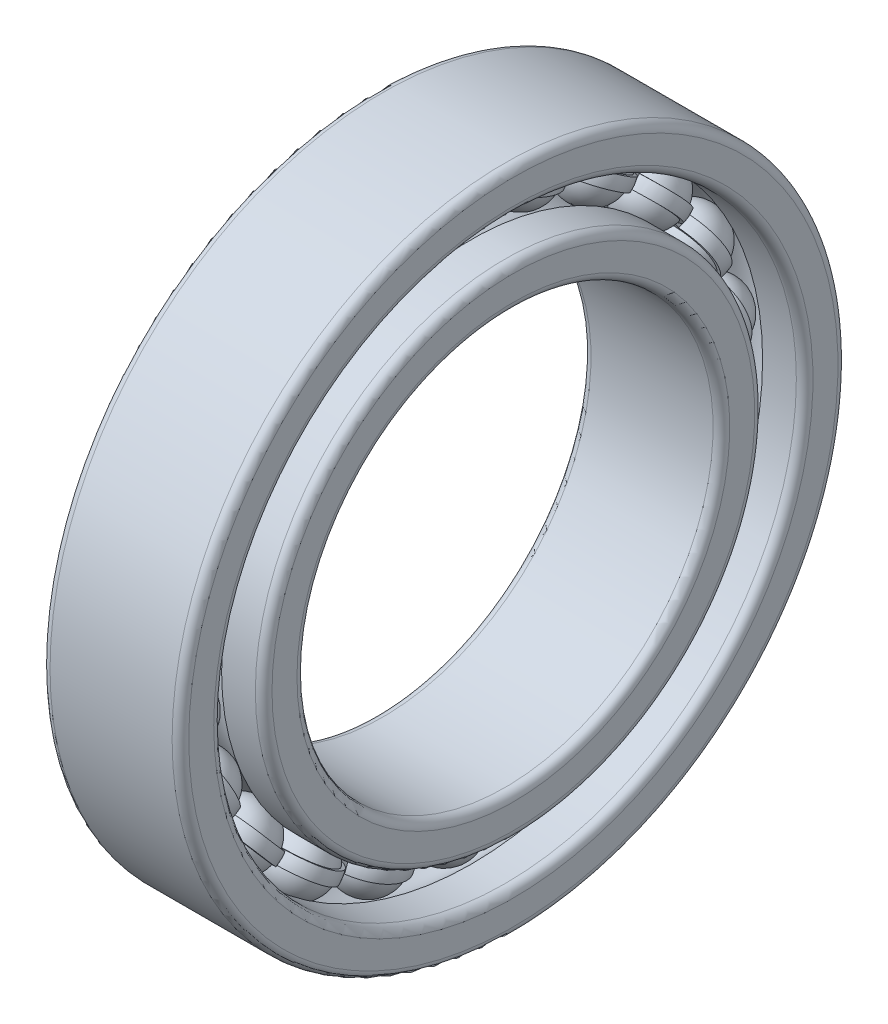
from build123d import *
from build123d.topology import SkipClean

# Parameters (mm, degrees)
SKETCH_5_W               = 0.6749999999999998
SKETCH_5_H               = 0.45000000000000107
PATTERN_CIRCULAR_5_COUNT = 22
PATTERN_CIRCULAR_2_COUNT = 22


with BuildPart() as part:
    # 草图2 → 旋转1 (revolve)
    with BuildSketch(Plane.XY):
        with BuildLine():
            Line((2.2000000000000015, 7.5), (-2.199999999999999, 7.499999999999998))
            ThreePointArc((-2.199999999999999, 7.499999999999998), (-2.412132034355963, 7.587867965644034), (-2.4999999999999987, 7.799999999999998))
            Line((-2.4999999999999987, 7.799999999999998), (-2.499999999999998, 8.7))
            ThreePointArc((-2.499999999999998, 8.7), (-2.4121320343559622, 8.912132034355963), (-2.199999999999999, 8.999999999999998))
            Line((-2.199999999999999, 8.999999999999998), (-0.838525491562419, 8.999999999999998))
            ThreePointArc((-0.838525491562419, 8.999999999999998), (4.2e-16, 8.625), (0.838525491562419, 8.999999999999998))
            Line((0.838525491562419, 8.999999999999998), (2.2000000000000015, 8.999999999999998))
            ThreePointArc((2.2000000000000015, 8.999999999999998), (2.412132034355965, 8.912132034355963), (2.5000000000000004, 8.7))
            Line((2.5000000000000004, 8.7), (2.5000000000000013, 7.8))
            ThreePointArc((2.5000000000000013, 7.8), (2.412132034355966, 7.587867965644036), (2.2000000000000015, 7.5))
        make_face()
        with BuildLine():
            Line((-2.4999999999999982, 11.700000000000001), (-2.4999999999999987, 10.8))
            ThreePointArc((-2.4999999999999987, 10.8), (-2.412132034355963, 10.587867965644037), (-2.199999999999999, 10.5))
            Line((-2.199999999999999, 10.5), (-0.8385254915624187, 10.500000000000002))
            ThreePointArc((-0.8385254915624187, 10.500000000000002), (6.7e-16, 10.874999999999998), (0.8385254915624187, 10.500000000000002))
            Line((0.8385254915624187, 10.500000000000002), (2.2000000000000015, 10.500000000000002))
            ThreePointArc((2.2000000000000015, 10.500000000000002), (2.412132034355965, 10.587867965644037), (2.5000000000000004, 10.8))
            Line((2.5000000000000004, 10.8), (2.5000000000000013, 11.700000000000001))
            ThreePointArc((2.5000000000000013, 11.700000000000001), (2.412132034355966, 11.912132034355965), (2.2000000000000015, 12))
            Line((2.2000000000000015, 12), (-2.199999999999999, 12))
            ThreePointArc((-2.199999999999999, 12), (-2.4121320343559622, 11.912132034355965), (-2.4999999999999982, 11.700000000000001))
        make_face()
    revolve(axis=Axis((-3.4999999999999996, 0, 0), (1, 0, 0)))


with BuildPart() as body_2:
    # 草图5 → 旋转3 (revolve)
    with BuildSketch(Plane.XY):
        with Locations((3.36e-15, 9.75)):
            Rectangle(SKETCH_5_W, SKETCH_5_H)
    revolve(axis=Axis((-19.927092192426834, 0, 0), (1, 0, 0)))



with BuildPart() as body_3:
    # 草图3 → 旋转2 (revolve)
    with BuildSketch(Plane.XY):
        with BuildLine():
            ThreePointArc((1.2374999999999976, 9.75), (-1.6e-16, 10.987499999999995), (-1.2374999999999976, 9.75))
            Line((-1.2374999999999978, 9.75), (1.2374999999999978, 9.75))
        make_face()
    revolve(axis=Axis((-1.2374999999999978, 9.75, 0), (1, 0, 0)))


with BuildPart() as pattern_circular_5_1:
    # 阵列(圆周)5: pattern copy
    add(body_3.part.rotate(Axis((-3.850000000000002, 0, 0), (1, 0, 0)), 1 * 360 / PATTERN_CIRCULAR_5_COUNT))


with BuildPart() as pattern_circular_5_2:
    # 阵列(圆周)5: pattern copy
    add(body_3.part.rotate(Axis((-3.850000000000002, 0, 0), (1, 0, 0)), 2 * 360 / PATTERN_CIRCULAR_5_COUNT))


with BuildPart() as pattern_circular_5_3:
    # 阵列(圆周)5: pattern copy
    add(body_3.part.rotate(Axis((-3.850000000000002, 0, 0), (1, 0, 0)), 3 * 360 / PATTERN_CIRCULAR_5_COUNT))


with BuildPart() as pattern_circular_5_4:
    # 阵列(圆周)5: pattern copy
    add(body_3.part.rotate(Axis((-3.850000000000002, 0, 0), (1, 0, 0)), 4 * 360 / PATTERN_CIRCULAR_5_COUNT))


with BuildPart() as pattern_circular_5_5:
    # 阵列(圆周)5: pattern copy
    add(body_3.part.rotate(Axis((-3.850000000000002, 0, 0), (1, 0, 0)), 5 * 360 / PATTERN_CIRCULAR_5_COUNT))


with BuildPart() as pattern_circular_5_6:
    # 阵列(圆周)5: pattern copy
    add(body_3.part.rotate(Axis((-3.850000000000002, 0, 0), (1, 0, 0)), 6 * 360 / PATTERN_CIRCULAR_5_COUNT))


with BuildPart() as pattern_circular_5_7:
    # 阵列(圆周)5: pattern copy
    add(body_3.part.rotate(Axis((-3.850000000000002, 0, 0), (1, 0, 0)), 7 * 360 / PATTERN_CIRCULAR_5_COUNT))


with BuildPart() as pattern_circular_5_8:
    # 阵列(圆周)5: pattern copy
    add(body_3.part.rotate(Axis((-3.850000000000002, 0, 0), (1, 0, 0)), 8 * 360 / PATTERN_CIRCULAR_5_COUNT))


with BuildPart() as pattern_circular_5_9:
    # 阵列(圆周)5: pattern copy
    add(body_3.part.rotate(Axis((-3.850000000000002, 0, 0), (1, 0, 0)), 9 * 360 / PATTERN_CIRCULAR_5_COUNT))


with BuildPart() as pattern_circular_5_10:
    # 阵列(圆周)5: pattern copy
    add(body_3.part.rotate(Axis((-3.850000000000002, 0, 0), (1, 0, 0)), 10 * 360 / PATTERN_CIRCULAR_5_COUNT))


with BuildPart() as pattern_circular_5_11:
    # 阵列(圆周)5: pattern copy
    add(body_3.part.rotate(Axis((-3.850000000000002, 0, 0), (1, 0, 0)), 11 * 360 / PATTERN_CIRCULAR_5_COUNT))


with BuildPart() as pattern_circular_5_12:
    # 阵列(圆周)5: pattern copy
    add(body_3.part.rotate(Axis((-3.850000000000002, 0, 0), (1, 0, 0)), 12 * 360 / PATTERN_CIRCULAR_5_COUNT))


with BuildPart() as pattern_circular_5_13:
    # 阵列(圆周)5: pattern copy
    add(body_3.part.rotate(Axis((-3.850000000000002, 0, 0), (1, 0, 0)), 13 * 360 / PATTERN_CIRCULAR_5_COUNT))


with BuildPart() as pattern_circular_5_14:
    # 阵列(圆周)5: pattern copy
    add(body_3.part.rotate(Axis((-3.850000000000002, 0, 0), (1, 0, 0)), 14 * 360 / PATTERN_CIRCULAR_5_COUNT))


with BuildPart() as pattern_circular_5_15:
    # 阵列(圆周)5: pattern copy
    add(body_3.part.rotate(Axis((-3.850000000000002, 0, 0), (1, 0, 0)), 15 * 360 / PATTERN_CIRCULAR_5_COUNT))


with BuildPart() as pattern_circular_5_16:
    # 阵列(圆周)5: pattern copy
    add(body_3.part.rotate(Axis((-3.850000000000002, 0, 0), (1, 0, 0)), 16 * 360 / PATTERN_CIRCULAR_5_COUNT))


with BuildPart() as pattern_circular_5_17:
    # 阵列(圆周)5: pattern copy
    add(body_3.part.rotate(Axis((-3.850000000000002, 0, 0), (1, 0, 0)), 17 * 360 / PATTERN_CIRCULAR_5_COUNT))


with BuildPart() as pattern_circular_5_18:
    # 阵列(圆周)5: pattern copy
    add(body_3.part.rotate(Axis((-3.850000000000002, 0, 0), (1, 0, 0)), 18 * 360 / PATTERN_CIRCULAR_5_COUNT))


with BuildPart() as pattern_circular_5_19:
    # 阵列(圆周)5: pattern copy
    add(body_3.part.rotate(Axis((-3.850000000000002, 0, 0), (1, 0, 0)), 19 * 360 / PATTERN_CIRCULAR_5_COUNT))


with BuildPart() as pattern_circular_5_20:
    # 阵列(圆周)5: pattern copy
    add(body_3.part.rotate(Axis((-3.850000000000002, 0, 0), (1, 0, 0)), 20 * 360 / PATTERN_CIRCULAR_5_COUNT))


with BuildPart() as pattern_circular_5_21:
    # 阵列(圆周)5: pattern copy
    add(body_3.part.rotate(Axis((-3.850000000000002, 0, 0), (1, 0, 0)), 21 * 360 / PATTERN_CIRCULAR_5_COUNT))


with BuildPart() as cut_revolve_1_tool:
    # 草图6 → 切除-旋转1 (revolve)
    with BuildSketch(Plane.XY):
        with BuildLine():
            Line((-1.2168735554690948, 9.974999999999998), (1.2168735554690948, 9.974999999999998))
            ThreePointArc((1.2168735554690948, 9.974999999999998), (1.65e-15, 10.987499999999997), (-1.2168735554690948, 9.974999999999998))
        make_face()
        with BuildLine():
            Line((-1.2168735554690948, 9.525000000000002), (1.2168735554690948, 9.525000000000002))
            ThreePointArc((1.2168735554690948, 9.525000000000002), (1.65e-15, 8.5125), (-1.2168735554690948, 9.525000000000002))
        make_face()
    revolve(axis=Axis((-19.927092192426834, 0, 0), (1, 0, 0)))


with BuildPart() as part_1:
    add(part.part)

    # 切除-旋转1: cut by cut_revolve_1_tool
    add(cut_revolve_1_tool.part, mode=Mode.SUBTRACT)


with BuildPart() as body_3_1:
    add(body_3.part)

    # 切除-旋转1: cut by cut_revolve_1_tool
    add(cut_revolve_1_tool.part, mode=Mode.SUBTRACT)


with BuildPart() as pattern_circular_5_1_1:
    add(pattern_circular_5_1.part)

    # 切除-旋转1: cut by cut_revolve_1_tool
    add(cut_revolve_1_tool.part, mode=Mode.SUBTRACT)


with BuildPart() as pattern_circular_5_2_1:
    add(pattern_circular_5_2.part)

    # 切除-旋转1: cut by cut_revolve_1_tool
    add(cut_revolve_1_tool.part, mode=Mode.SUBTRACT)


with BuildPart() as pattern_circular_5_3_1:
    add(pattern_circular_5_3.part)

    # 切除-旋转1: cut by cut_revolve_1_tool
    add(cut_revolve_1_tool.part, mode=Mode.SUBTRACT)


with BuildPart() as pattern_circular_5_4_1:
    add(pattern_circular_5_4.part)

    # 切除-旋转1: cut by cut_revolve_1_tool
    add(cut_revolve_1_tool.part, mode=Mode.SUBTRACT)


with BuildPart() as pattern_circular_5_5_1:
    add(pattern_circular_5_5.part)

    # 切除-旋转1: cut by cut_revolve_1_tool
    add(cut_revolve_1_tool.part, mode=Mode.SUBTRACT)


with BuildPart() as pattern_circular_5_6_1:
    add(pattern_circular_5_6.part)

    # 切除-旋转1: cut by cut_revolve_1_tool
    add(cut_revolve_1_tool.part, mode=Mode.SUBTRACT)


with BuildPart() as pattern_circular_5_7_1:
    add(pattern_circular_5_7.part)

    # 切除-旋转1: cut by cut_revolve_1_tool
    add(cut_revolve_1_tool.part, mode=Mode.SUBTRACT)


with BuildPart() as pattern_circular_5_8_1:
    add(pattern_circular_5_8.part)

    # 切除-旋转1: cut by cut_revolve_1_tool
    add(cut_revolve_1_tool.part, mode=Mode.SUBTRACT)


with BuildPart() as pattern_circular_5_9_1:
    add(pattern_circular_5_9.part)

    # 切除-旋转1: cut by cut_revolve_1_tool
    add(cut_revolve_1_tool.part, mode=Mode.SUBTRACT)


with BuildPart() as pattern_circular_5_10_1:
    add(pattern_circular_5_10.part)

    # 切除-旋转1: cut by cut_revolve_1_tool
    add(cut_revolve_1_tool.part, mode=Mode.SUBTRACT)


with BuildPart() as pattern_circular_5_11_1:
    add(pattern_circular_5_11.part)

    # 切除-旋转1: cut by cut_revolve_1_tool
    add(cut_revolve_1_tool.part, mode=Mode.SUBTRACT)


with BuildPart() as pattern_circular_5_12_1:
    add(pattern_circular_5_12.part)

    # 切除-旋转1: cut by cut_revolve_1_tool
    add(cut_revolve_1_tool.part, mode=Mode.SUBTRACT)


with BuildPart() as pattern_circular_5_13_1:
    add(pattern_circular_5_13.part)

    # 切除-旋转1: cut by cut_revolve_1_tool
    add(cut_revolve_1_tool.part, mode=Mode.SUBTRACT)


with BuildPart() as pattern_circular_5_14_1:
    add(pattern_circular_5_14.part)

    # 切除-旋转1: cut by cut_revolve_1_tool
    add(cut_revolve_1_tool.part, mode=Mode.SUBTRACT)


with BuildPart() as pattern_circular_5_15_1:
    add(pattern_circular_5_15.part)

    # 切除-旋转1: cut by cut_revolve_1_tool
    add(cut_revolve_1_tool.part, mode=Mode.SUBTRACT)


with BuildPart() as pattern_circular_5_16_1:
    add(pattern_circular_5_16.part)

    # 切除-旋转1: cut by cut_revolve_1_tool
    add(cut_revolve_1_tool.part, mode=Mode.SUBTRACT)


with BuildPart() as pattern_circular_5_17_1:
    add(pattern_circular_5_17.part)

    # 切除-旋转1: cut by cut_revolve_1_tool
    add(cut_revolve_1_tool.part, mode=Mode.SUBTRACT)


with BuildPart() as pattern_circular_5_18_1:
    add(pattern_circular_5_18.part)

    # 切除-旋转1: cut by cut_revolve_1_tool
    add(cut_revolve_1_tool.part, mode=Mode.SUBTRACT)


with BuildPart() as pattern_circular_5_19_1:
    add(pattern_circular_5_19.part)

    # 切除-旋转1: cut by cut_revolve_1_tool
    add(cut_revolve_1_tool.part, mode=Mode.SUBTRACT)


with BuildPart() as pattern_circular_5_20_1:
    add(pattern_circular_5_20.part)

    # 切除-旋转1: cut by cut_revolve_1_tool
    add(cut_revolve_1_tool.part, mode=Mode.SUBTRACT)


with BuildPart() as pattern_circular_5_21_1:
    add(pattern_circular_5_21.part)

    # 切除-旋转1: cut by cut_revolve_1_tool
    add(cut_revolve_1_tool.part, mode=Mode.SUBTRACT)


with BuildPart() as body_2_1:
    with SkipClean():  # the faces are left unmerged after this step: merging them gives an invalid solid
        add(body_2.part)

        add(body_3_1.part)  # 旋转4 merges body 3
        # 草图7 → 旋转4 (revolve)
        with BuildSketch(Plane.XY):
            with BuildLine():
                Line((-1.1249999999999993, 9.75), (1.1249999999999993, 9.75))
                ThreePointArc((1.1249999999999993, 9.75), (1.92e-15, 10.874999999999998), (-1.1249999999999993, 9.75))
            make_face()
        revolve_4 = revolve(axis=Axis((-1.1249999999999993, 9.75, 0), (1, 0, 0)))

    # 阵列(圆周)2: 旋转4 ×22 about axis
    with SkipClean():  # the faces are left unmerged after this step: merging them gives an invalid solid
        pattern_circular_2_axis = Axis((-3.850000000000002, 0, 0), (1, 0, 0))
        for i in range(1, PATTERN_CIRCULAR_2_COUNT):
            add(revolve_4.rotate(pattern_circular_2_axis, i * 360 / PATTERN_CIRCULAR_2_COUNT))


solid = Compound([part_1.part, pattern_circular_5_1_1.part, pattern_circular_5_2_1.part, pattern_circular_5_3_1.part, pattern_circular_5_4_1.part, pattern_circular_5_5_1.part, pattern_circular_5_6_1.part, pattern_circular_5_7_1.part, pattern_circular_5_8_1.part, pattern_circular_5_9_1.part, pattern_circular_5_10_1.part, pattern_circular_5_11_1.part, pattern_circular_5_12_1.part, pattern_circular_5_13_1.part, pattern_circular_5_14_1.part, pattern_circular_5_15_1.part, pattern_circular_5_16_1.part, pattern_circular_5_17_1.part, pattern_circular_5_18_1.part, pattern_circular_5_19_1.part, pattern_circular_5_20_1.part, pattern_circular_5_21_1.part, body_2_1.part])
